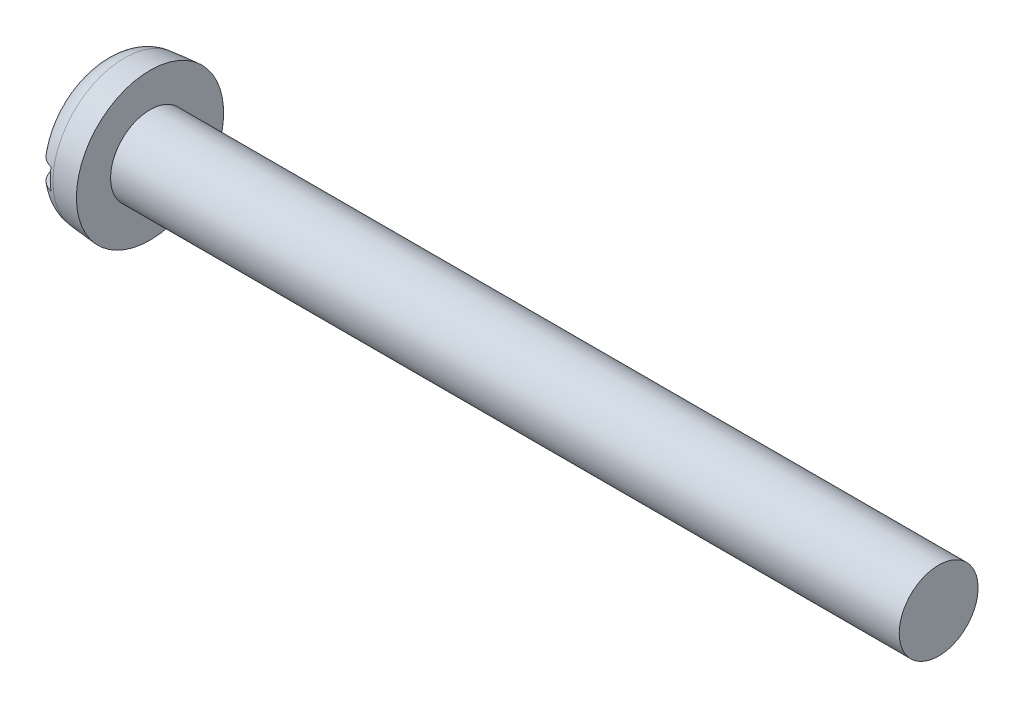
from build123d import *

# Parameters (mm, degrees)
SKETCH2_W  = 5.6
SKETCH2_H  = 0.8
SLOT_DEPTH = 0.7


with BuildPart() as part:
    # Fillet2: read off the stored shape, not the designer's step
    # Fillet2 outline → Fillet2 (revolve)
    with BuildSketch(Plane.YX):
        with BuildLine():
            Line((1.5, 1.8), (1.5, 31.8))
            Line((1.5, 31.8), (0, 31.8))
            Line((0, 31.8), (0, 0))
            Line((0, 0), (1.817822349, 0))
            ThreePointArc((1.817822349, 0), (2.425853536, 0.236450397), (2.714397577, 0.821559832))
            Line((2.714397577, 0.821559832), (2.8, 1.8))
            Line((2.8, 1.8), (1.5, 1.8))
        make_face()
    revolve(axis=Axis((0, 0, 0), (1, 0, 0)))

    # Sketch2 → Slot (cut)
    with BuildSketch(Plane(origin=(0, 0, 0), x_dir=(0, 0, -1), z_dir=(1, 0, 0))):
        Rectangle(SKETCH2_W, SKETCH2_H)
    extrude(amount=SLOT_DEPTH, mode=Mode.SUBTRACT)


solid = part.part
